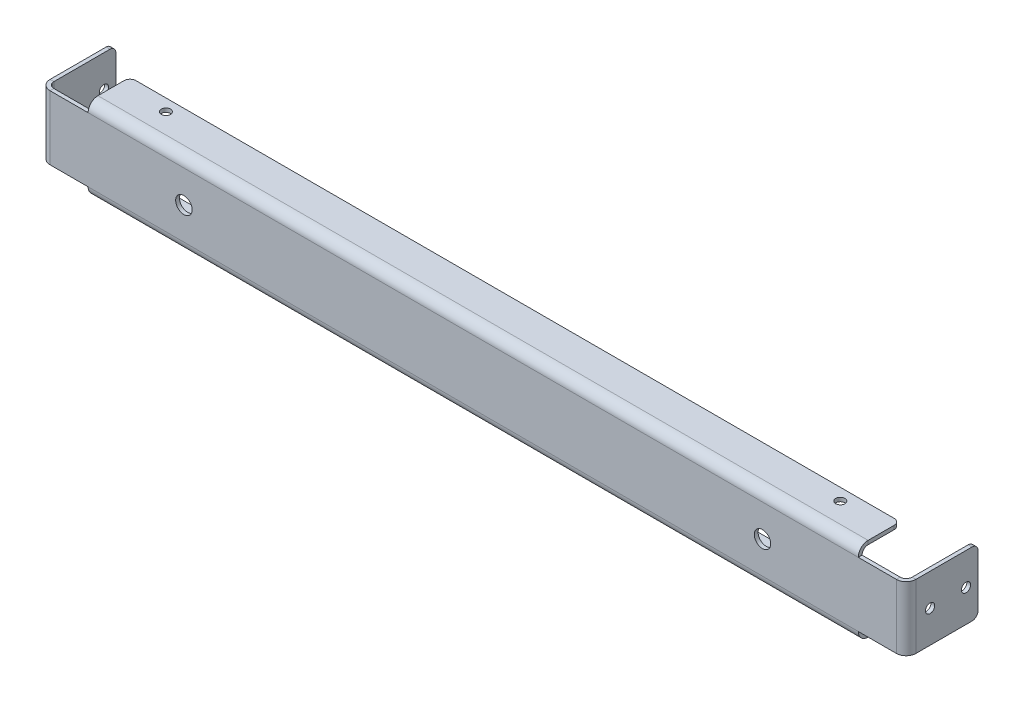
from build123d import *

# Parameters (mm, degrees)
BASE_FLANGE1_DEPTH           = 408.432
SKETCH2_W                    = 2.032
SKETCH2_H                    = 34.036
BOSS_EXTRUDE1_DEPTH          = 25.4
EDGE_FLANGE1_STRIP_W         = 14.478
EDGE_FLANGE1_STRIP_H         = 2.032
EDGE_FLANGE1_STRIP_CUT_DEPTH = 34.036
EDGE_FLANGE1_DEPTH           = 34.036
SKETCH6_R                    = 2.4511
CUT_EXTRUDE1_DEPTH           = 438.764339256
SKETCH7_R                    = 4.3688
CUT_EXTRUDE2_DEPTH           = 438.764339256
SKETCH8_R                    = 2.4511
CUT_EXTRUDE3_DEPTH           = 463.94863897
FILLET1_R                    = 3.175


# Sheet-metal steps are written as plain solids
with BuildPart() as part:
    # Sketch1 → Base-Flange1 (new body)
    with BuildSketch(Plane(origin=(0, 0, 0), x_dir=(0, 0, -1), z_dir=(1, 0, 0))):
        with BuildLine():
            Line((22.225, 0), (5.207, 0))
            ThreePointArc((5.207, 0), (1.52509499, 1.52509499), (0, 5.207))
            Line((0, 5.207), (0, 39.243))
            ThreePointArc((0, 39.243), (1.52509499, 42.92490501), (5.207, 44.45))
            Line((5.207, 44.45), (22.225, 44.45))
            Line((22.225, 44.45), (22.225, 42.418))
            Line((22.225, 42.418), (5.207, 42.418))
            ThreePointArc((5.207, 42.418), (2.96193597, 41.48806403), (2.032, 39.243))
            Line((2.032, 39.243), (2.032, 5.207))
            ThreePointArc((2.032, 5.207), (2.96193597, 2.96193597), (5.207, 2.032))
            Line((5.207, 2.032), (22.225, 2.032))
            Line((22.225, 2.032), (22.225, 0))
        make_face()
    extrude(amount=BASE_FLANGE1_DEPTH)

    # Sketch2 → Boss-Extrude1 (add)
    with BuildSketch(Plane(origin=(408.432, 0, 0), x_dir=(0, 0, -1), z_dir=(1, 0, 0))):
        with Locations((1.016, 22.225)):
            Rectangle(SKETCH2_W, SKETCH2_H)
    boss_extrude1 = extrude(amount=BOSS_EXTRUDE1_DEPTH)

    # Edge-Flange1 strip (across the edge) → Edge-Flange1 strip cut (cut)
    with BuildSketch(Plane(origin=(433.832, 39.243, -2.032), x_dir=(-1, 0, 0), z_dir=(0, -1, 0))):
        with Locations((-2.032, -1.016)):
            Rectangle(EDGE_FLANGE1_STRIP_W, EDGE_FLANGE1_STRIP_H)
    edge_flange1_strip_cut = extrude(amount=EDGE_FLANGE1_STRIP_CUT_DEPTH, mode=Mode.SUBTRACT)

    # Edge-Flange1 section (across the edge) → Edge-Flange1 (add)
    with BuildSketch(Plane(origin=(433.832, 39.243, -2.032), x_dir=(-1, 0, 0), z_dir=(0, -1, 0))):
        with BuildLine():
            Line((0, 3.175), (0, 36.068))
            Line((0, 36.068), (2.032, 36.068))
            Line((2.032, 36.068), (2.032, 3.175))
            ThreePointArc((2.032, 3.175), (2.96193597, 0.92993597), (5.207, 0))
            Line((5.207, 0), (5.207, -2.032))
            ThreePointArc((5.207, -2.032), (1.52509499, -0.50690501), (0, 3.175))
        make_face()
    edge_flange1 = extrude(amount=EDGE_FLANGE1_DEPTH)

    # Mirror1: Boss-Extrude1, Edge-Flange1 strip cut, Edge-Flange1 across plane
    add(boss_extrude1.mirror(Plane.ZY.offset(-204.216)))
    add(edge_flange1_strip_cut.mirror(Plane.ZY.offset(-204.216)), mode=Mode.SUBTRACT)
    add(edge_flange1.mirror(Plane.ZY.offset(-204.216)))

    # Sketch6 → Cut-Extrude1 (cut, through all)
    with BuildSketch(Plane(origin=(0, 44.45, 0), x_dir=(1, 0, 0), z_dir=(0, 1, 0))):
        with Locations(Location((25.4, 15.875, 0), (0, 0, 270))):
            Circle(SKETCH6_R)
        with Locations(Location((383.032, 15.875, 0), (0, 0, 270))):
            Circle(SKETCH6_R)
    extrude(amount=-CUT_EXTRUDE1_DEPTH, mode=Mode.SUBTRACT)

    # Sketch7 → Cut-Extrude2 (cut, through all)
    with BuildSketch(Plane.XY):
        with Locations((50.8, 22.225)):
            Circle(SKETCH7_R)
        with Locations((357.632, 22.225)):
            Circle(SKETCH7_R)
    extrude(amount=-CUT_EXTRUDE2_DEPTH, mode=Mode.SUBTRACT)

    # Sketch8 → Cut-Extrude3 (cut, through all)
    with BuildSketch(Plane(origin=(433.832, 0, 0), x_dir=(0, 0, -1), z_dir=(1, 0, 0))):
        with Locations((31.75, 22.225)):
            Circle(SKETCH8_R)
        with Locations((12.7, 22.225)):
            Circle(SKETCH8_R)
    extrude(amount=-CUT_EXTRUDE3_DEPTH, mode=Mode.SUBTRACT)

    # Fillet1
    fillet1_edges = [part.edges().sort_by_distance(p)[0] for p in [
        (-24.384, 5.207, -38.1),
        (0, 1.016, -22.225),
        (-24.384, 39.243, -38.1),
        (0, 43.434, -22.225),
        (408.432, 1.016, -22.225),
        (432.816, 39.243, -38.1),
        (432.816, 5.207, -38.1),
        (408.432, 43.434, -22.225),
    ]]
    fillet(fillet1_edges, radius=FILLET1_R)


solid = part.part
